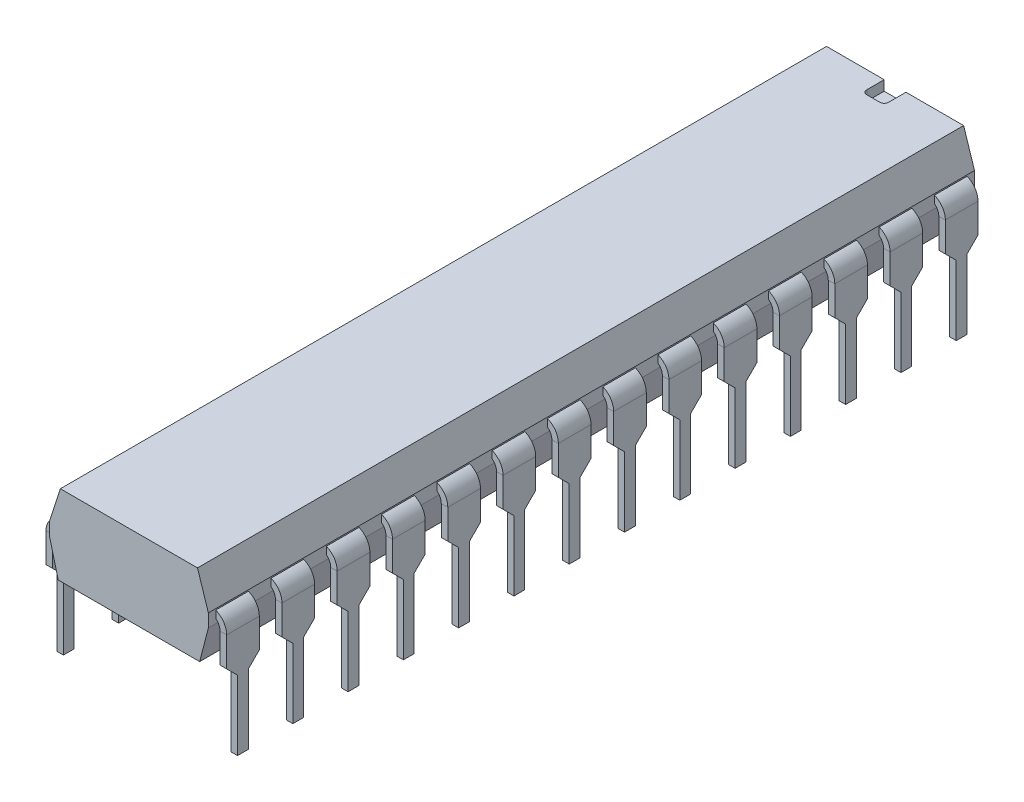
from build123d import *

# Parameters (mm, degrees)
BODY_FEATURE_DEPTH                    = 1.84
BODY_FEATURE_DEPTH_BACK               = 1.84
SKETCH1_W                             = 7.3
SKETCH1_H                             = 35.2
BEVEL_FEATURE_DEPTH                   = 35.2
BEVEL_FEATURE_DEPTH_BACK              = 35.2
SIGN_FEATURE_DEPTH                    = 0.46
FIRST_AND_LAST_PIN_FEATURE_DEPTH      = 0.75
FIRST_AND_LAST_PIN_FEATURE_DEPTH_BACK = 0.75
PIN_PROFILE_FEATURE_DEPTH             = 10
PIN_PROFILE_FEATURE_DEPTH_BACK        = 10
OTHER_PINS_FEATURE_COUNT              = 14
OTHER_PINS_FEATURE_PITCH              = 2.54


# Sheet-metal steps are written as plain solids
with BuildPart() as part:
    # Sketch1 → Body Feature (new, two sides: drawn at the far end of the back side and taken through both)
    with BuildSketch(Plane(origin=(0, 0, 0), x_dir=(1, 0, 0), z_dir=(0, 1, 0)).offset(-BODY_FEATURE_DEPTH_BACK)):
        Rectangle(SKETCH1_W, SKETCH1_H)
    extrude(amount=BODY_FEATURE_DEPTH + BODY_FEATURE_DEPTH_BACK)

    # Sketch2 → Bevel Feature (cut, two sides: drawn at the far end of the back side and taken through both)
    with BuildSketch(Plane.XY.offset(-BEVEL_FEATURE_DEPTH_BACK)):
        Polygon((-13.65, 1.882711437), (-10.417114103, 11.84), (10.417114103, 11.84), (13.65, 1.882711437), (13.65, -1.577506206), (10.984417196, -11.84), (-10.984417196, -11.84), (-13.65, -1.577506206), align=None)
        Polygon((-3.65, 0.3), (-3.15, 1.84), (3.15, 1.84), (3.65, 0.3), (3.65, -0.3), (3.25, -1.84), (-3.25, -1.84), (-3.65, -0.3), align=None, mode=Mode.SUBTRACT)
    extrude(amount=BEVEL_FEATURE_DEPTH + BEVEL_FEATURE_DEPTH_BACK, mode=Mode.SUBTRACT)

    # Sketch3 → Sign Feature (cut)
    with BuildSketch(Plane(origin=(0, 1.84, 0), x_dir=(1, 0, 0), z_dir=(0, 1, 0))):
        with BuildLine():
            Line((-0.3, 16.6), (0.3, 16.6))
            ThreePointArc((0.3, 16.6), (0.441421356, 16.658578644), (0.5, 16.8))
            Line((0.5, 16.8), (0.5, 18.4))
            ThreePointArc((0.5, 18.4), (0.441421356, 18.541421356), (0.3, 18.6))
            Line((0.3, 18.6), (-0.3, 18.6))
            ThreePointArc((-0.3, 18.6), (-0.441421356, 18.541421356), (-0.5, 18.4))
            Line((-0.5, 18.4), (-0.5, 16.8))
            ThreePointArc((-0.5, 16.8), (-0.441421356, 16.658578644), (-0.3, 16.6))
        make_face()
    extrude(amount=-SIGN_FEATURE_DEPTH, mode=Mode.SUBTRACT)


with BuildPart() as body_2:
    # Sketch4 → First and Last Pin Feature (new, two sides: drawn at the far end of the back side and taken through both)
    with BuildSketch(Plane.XY.offset(-16.51).offset(-FIRST_AND_LAST_PIN_FEATURE_DEPTH_BACK)):
        with BuildLine():
            Line((-4.15, -5.55), (-4.15, -0.5))
            ThreePointArc((-4.15, -0.5), (-3.915685425, 0.065685425), (-3.35, 0.3))
            Line((-3.35, 0.3), (3.35, 0.3))
            ThreePointArc((3.35, 0.3), (3.915685425, 0.065685425), (4.15, -0.5))
            Line((4.15, -0.5), (4.15, -5.55))
            Line((4.15, -5.55), (3.85, -5.55))
            Line((3.85, -5.55), (3.85, -0.5))
            ThreePointArc((3.85, -0.5), (3.703553391, -0.146446609), (3.35, 0))
            Line((3.35, 0), (-3.35, 0))
            ThreePointArc((-3.35, 0), (-3.703553391, -0.146446609), (-3.85, -0.5))
            Line((-3.85, -0.5), (-3.85, -5.55))
            Line((-3.85, -5.55), (-4.15, -5.55))
        make_face()
    extrude(amount=FIRST_AND_LAST_PIN_FEATURE_DEPTH + FIRST_AND_LAST_PIN_FEATURE_DEPTH_BACK)

    # Sketch9 → Pin Profile Feature (cut, two sides: drawn at the far end of the back side and taken through both)
    with BuildSketch(Plane(origin=(0, 0, 0), x_dir=(0, 0, -1), z_dir=(1, 0, 0)).offset(-PIN_PROFILE_FEATURE_DEPTH_BACK)):
        Polygon((16.26, -5.55), (16.26, -2.35), (15.755, -1.845), (15.755, -6.55), (17.26, -6.55), (17.26, -1.845), (16.755, -2.35), (16.755, -5.55), align=None)
    extrude(amount=PIN_PROFILE_FEATURE_DEPTH + PIN_PROFILE_FEATURE_DEPTH_BACK, mode=Mode.SUBTRACT)


with BuildPart() as other_pins_feature_1:
    # Other Pins Feature: pattern copy
    add(body_2.part.moved(Location(Vector(0, 0, 1) * (1 * OTHER_PINS_FEATURE_PITCH))))


with BuildPart() as other_pins_feature_2:
    # Other Pins Feature: pattern copy
    add(body_2.part.moved(Location(Vector(0, 0, 1) * (2 * OTHER_PINS_FEATURE_PITCH))))


with BuildPart() as other_pins_feature_3:
    # Other Pins Feature: pattern copy
    add(body_2.part.moved(Location(Vector(0, 0, 1) * (3 * OTHER_PINS_FEATURE_PITCH))))


with BuildPart() as other_pins_feature_4:
    # Other Pins Feature: pattern copy
    add(body_2.part.moved(Location(Vector(0, 0, 1) * (4 * OTHER_PINS_FEATURE_PITCH))))


with BuildPart() as other_pins_feature_5:
    # Other Pins Feature: pattern copy
    add(body_2.part.moved(Location(Vector(0, 0, 1) * (5 * OTHER_PINS_FEATURE_PITCH))))


with BuildPart() as other_pins_feature_6:
    # Other Pins Feature: pattern copy
    add(body_2.part.moved(Location(Vector(0, 0, 1) * (6 * OTHER_PINS_FEATURE_PITCH))))


with BuildPart() as other_pins_feature_7:
    # Other Pins Feature: pattern copy
    add(body_2.part.moved(Location(Vector(0, 0, 1) * (7 * OTHER_PINS_FEATURE_PITCH))))


with BuildPart() as other_pins_feature_8:
    # Other Pins Feature: pattern copy
    add(body_2.part.moved(Location(Vector(0, 0, 1) * (8 * OTHER_PINS_FEATURE_PITCH))))


with BuildPart() as other_pins_feature_9:
    # Other Pins Feature: pattern copy
    add(body_2.part.moved(Location(Vector(0, 0, 1) * (9 * OTHER_PINS_FEATURE_PITCH))))


with BuildPart() as other_pins_feature_10:
    # Other Pins Feature: pattern copy
    add(body_2.part.moved(Location(Vector(0, 0, 1) * (10 * OTHER_PINS_FEATURE_PITCH))))


with BuildPart() as other_pins_feature_11:
    # Other Pins Feature: pattern copy
    add(body_2.part.moved(Location(Vector(0, 0, 1) * (11 * OTHER_PINS_FEATURE_PITCH))))


with BuildPart() as other_pins_feature_12:
    # Other Pins Feature: pattern copy
    add(body_2.part.moved(Location(Vector(0, 0, 1) * (12 * OTHER_PINS_FEATURE_PITCH))))


with BuildPart() as other_pins_feature_13:
    # Other Pins Feature: pattern copy
    add(body_2.part.moved(Location(Vector(0, 0, 1) * (13 * OTHER_PINS_FEATURE_PITCH))))


solid = Compound([part.part, body_2.part, other_pins_feature_1.part, other_pins_feature_2.part, other_pins_feature_3.part, other_pins_feature_4.part, other_pins_feature_5.part, other_pins_feature_6.part, other_pins_feature_7.part, other_pins_feature_8.part, other_pins_feature_9.part, other_pins_feature_10.part, other_pins_feature_11.part, other_pins_feature_12.part, other_pins_feature_13.part])
